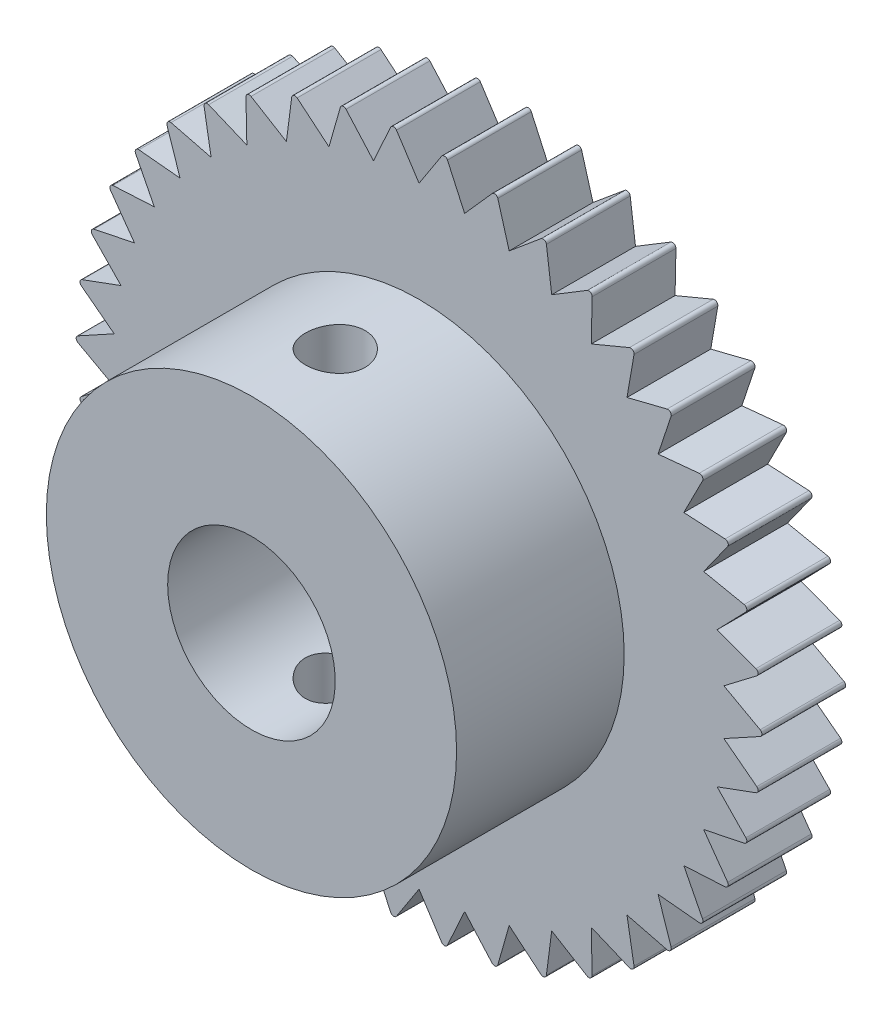
from build123d import *

# Parameters (mm, degrees)
CUT_EXTRUDE3_DEPTH      = 20.694780667
CUT_EXTRUDE3_DEPTH_BACK = 20.694780667
SKETCH3_OUTSIDE_W       = 36.062
SKETCH3_OUTSIDE_H       = 36.062
FILLET1_R               = 0.127
CUT_EXTRUDE4_DEPTH      = 21.669765453
CUT_EXTRUDE4_DEPTH_BACK = 21.669765453
SKETCH4_R               = 1.1303


with BuildPart() as part:
    # Sketch2 → Revolve1 (revolve)
    with BuildSketch(Plane(origin=(0, 0, 0), x_dir=(0, 0, -1), z_dir=(1, 0, 0))):
        Polygon((0, 3.175), (0, 13.1826), (-3.175, 13.1826), (-3.175, 7.7724), (-9.525, 7.7724), (-9.525, 3.175), align=None)
    revolve(axis=Axis((0, 0, -6.785443847), (0, 0, 1)))

    # Sketch3 outside → Cut-Extrude3 (cut, two sides: drawn at the far end of the back side and taken through both)
    with BuildSketch(Plane.XY.offset(3.175).offset(-CUT_EXTRUDE3_DEPTH_BACK)):
        Rectangle(SKETCH3_OUTSIDE_W, SKETCH3_OUTSIDE_H)
        Polygon((2.920854067, 12.797097812), (1.726267144, 11.453034162), (0.980922082, 13.089495512), (0, 11.5824), (-0.980922082, 13.089495512), (-1.726267144, 11.453034162), (-2.920854067, 12.797097812), (-3.413972332, 11.067826466), (-4.795538999, 12.218834094), (-5.02541502, 10.435381816), (-6.563099513, 11.367621812), (-6.524598241, 9.56982798), (-8.18405123, 10.262475644), (-7.878032718, 8.4905), (-9.622184767, 8.928082729), (-9.055484963, 7.221508281), (-10.845374595, 7.394251198), (-10.030652637, 5.7912), (-11.826296677, 5.695244314), (-10.781752106, 4.231525881), (-12.543038834, 3.869015084), (-11.29200505, 2.577326465), (-12.979590229, 1.956358449), (-11.55001326, 0.865553836), (-13.126199027, 0), (-11.55001326, -0.865553836), (-12.979590229, -1.956358449), (-11.29200505, -2.577326465), (-12.543038834, -3.869015084), (-10.781752106, -4.231525881), (-11.826296677, -5.695244314), (-10.030652637, -5.7912), (-10.845374595, -7.394251198), (-9.055484963, -7.221508281), (-9.622184767, -8.928082729), (-7.878032718, -8.4905), (-8.18405123, -10.262475644), (-6.524598241, -9.56982798), (-6.563099513, -11.367621812), (-5.02541502, -10.435381816), (-4.795538999, -12.218834094), (-3.413972332, -11.067826466), (-2.920854067, -12.797097812), (-1.726267144, -11.453034162), (-0.980922082, -13.089495512), (0, -11.5824), (0.980922082, -13.089495512), (1.726267144, -11.453034162), (2.920854067, -12.797097812), (3.413972332, -11.067826466), (4.795538999, -12.218834094), (5.02541502, -10.435381816), (6.563099513, -11.367621812), (6.524598241, -9.56982798), (8.18405123, -10.262475644), (7.878032718, -8.4905), (9.622184767, -8.928082729), (9.055484963, -7.221508281), (10.845374595, -7.394251198), (10.030652637, -5.7912), (11.826296677, -5.695244314), (10.781752106, -4.231525881), (12.543038834, -3.869015084), (11.29200505, -2.577326465), (12.979590229, -1.956358449), (11.55001326, -0.865553836), (13.126199027, 0), (11.55001326, 0.865553836), (12.979590229, 1.956358449), (11.29200505, 2.577326465), (12.543038834, 3.869015084), (10.781752106, 4.231525881), (11.826296677, 5.695244314), (10.030652637, 5.7912), (10.845374595, 7.394251198), (9.055484963, 7.221508281), (9.622184767, 8.928082729), (7.878032718, 8.4905), (8.18405123, 10.262475644), (6.524598241, 9.56982798), (6.563099513, 11.367621812), (5.02541502, 10.435381816), (4.795538999, 12.218834094), (3.413972332, 11.067826466), align=None, mode=Mode.SUBTRACT)
    extrude(amount=CUT_EXTRUDE3_DEPTH + CUT_EXTRUDE3_DEPTH_BACK, mode=Mode.SUBTRACT)

    # Fillet1
    fillet1_edges = [part.edges().sort_by_distance(p)[0] for p in [
        (-10.845374595, -7.394251198, 1.5875),
        (-11.826296677, -5.695244314, 1.5875),
        (-12.543038834, -3.869015084, 1.5875),
        (-12.979590229, -1.956358449, 1.5875),
        (-13.126199027, 0, 1.5875),
        (-12.979590229, 1.956358449, 1.5875),
        (-12.543038834, 3.869015084, 1.5875),
        (-11.826296677, 5.695244314, 1.5875),
        (-10.845374595, 7.394251198, 1.5875),
        (-9.622184767, 8.928082729, 1.5875),
        (-8.18405123, 10.262475644, 1.5875),
        (-6.563099513, 11.367621812, 1.5875),
        (-4.795538999, 12.218834094, 1.5875),
        (-2.920854067, 12.797097812, 1.5875),
        (-0.980922082, 13.089495512, 1.5875),
        (0.980922082, 13.089495512, 1.5875),
        (2.920854067, 12.797097812, 1.5875),
        (4.795538999, 12.218834094, 1.5875),
        (6.563099513, 11.367621812, 1.5875),
        (8.18405123, 10.262475644, 1.5875),
        (9.622184767, 8.928082729, 1.5875),
        (10.845374595, 7.394251198, 1.5875),
        (11.826296677, 5.695244314, 1.5875),
        (12.543038834, 3.869015084, 1.5875),
        (12.979590229, 1.956358449, 1.5875),
        (13.126199027, 0, 1.5875),
        (12.979590229, -1.956358449, 1.5875),
        (-9.622184767, -8.928082729, 1.5875),
        (-8.18405123, -10.262475644, 1.5875),
        (-6.563099513, -11.367621812, 1.5875),
        (-4.795538999, -12.218834094, 1.5875),
        (-2.920854067, -12.797097812, 1.5875),
        (-0.980922082, -13.089495512, 1.5875),
        (0.980922082, -13.089495512, 1.5875),
        (2.920854067, -12.797097812, 1.5875),
        (4.795538999, -12.218834094, 1.5875),
        (6.563099513, -11.367621812, 1.5875),
        (8.18405123, -10.262475644, 1.5875),
        (9.622184767, -8.928082729, 1.5875),
        (10.845374595, -7.394251198, 1.5875),
        (11.826296677, -5.695244314, 1.5875),
        (12.543038834, -3.869015084, 1.5875),
    ]]
    fillet(fillet1_edges, radius=FILLET1_R)

    # Sketch4 → Cut-Extrude4 (cut, two sides: drawn at the far end of the back side and taken through both)
    with BuildSketch(Plane(origin=(0, 0, 0), x_dir=(1, 0, 0), z_dir=(0, 1, 0)).offset(-CUT_EXTRUDE4_DEPTH_BACK)):
        with Locations((0, -6.35)):
            Circle(SKETCH4_R)
    extrude(amount=CUT_EXTRUDE4_DEPTH + CUT_EXTRUDE4_DEPTH_BACK, mode=Mode.SUBTRACT)


solid = part.part
